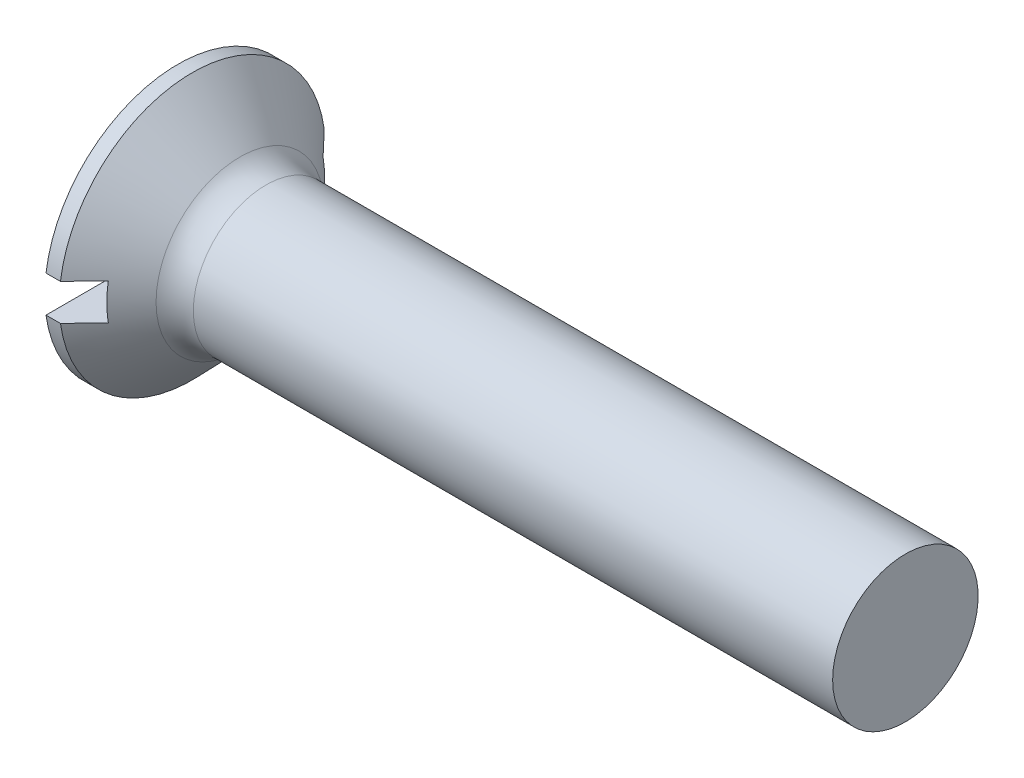
from build123d import *

# Parameters (mm, degrees)
FILLET1_R  = 2.5
SLOTSKE_W  = 18.3
SLOTSKE_H  = 2.5
SLOT_DEPTH = 2.6


with BuildPart() as part:
    # BodySke → BaseBody (revolve)
    with BuildSketch(Plane.XY):
        Polygon((0, 0), (0, 9.15), (0.992391585, 9.15), (5, 5), (50, 5), (50, 0), align=None)
    revolve(axis=Axis((0, 0, 0), (1, 0, 0)))

    # Fillet1
    fillet1_edges = [part.edges().sort_by_distance(p)[0] for p in [
        (5, -5, 0),
    ]]
    fillet(fillet1_edges, radius=FILLET1_R)

    # SlotSke → Slot (cut)
    with BuildSketch(Plane.ZY):
        Rectangle(SLOTSKE_W, SLOTSKE_H)
    extrude(amount=-SLOT_DEPTH, mode=Mode.SUBTRACT)


solid = part.part
